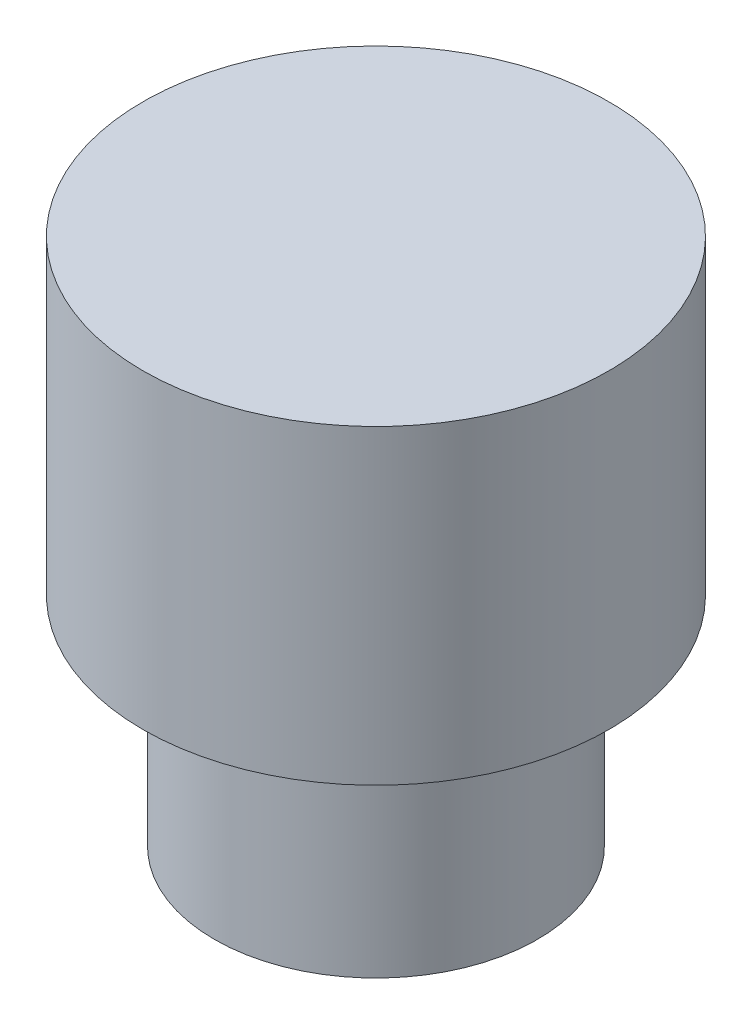
from build123d import *

# Parameters (mm, degrees)
SKETCH1_R           = 5.2
SKETCH1_R_2         = 3.2
BOSS_EXTRUDE1_DEPTH = 7
SKETCH2_R           = 7.5
BOSS_EXTRUDE2_DEPTH = 10
BOSS_EXTRUDE3_START = 0.8
BOSS_EXTRUDE3_DEPTH = 0.8


with BuildPart() as part:
    # Sketch1 → Boss-Extrude1 (new body)
    with BuildSketch(Plane(origin=(0, 0, 0), x_dir=(1, 0, 0), z_dir=(0, 1, 0))):
        Circle(SKETCH1_R)
        Circle(SKETCH1_R_2, mode=Mode.SUBTRACT)
    extrude(amount=BOSS_EXTRUDE1_DEPTH)

    # Sketch2 → Boss-Extrude2 (add)
    with BuildSketch(Plane(origin=(0, 7, 0), x_dir=(1, 0, 0), z_dir=(0, 1, 0))):
        Circle(SKETCH2_R)
    extrude(amount=BOSS_EXTRUDE2_DEPTH)

    # Sketch3 → Boss-Extrude3 (add)
    with BuildSketch(Plane.XZ.offset(-7).offset(BOSS_EXTRUDE3_START)):
        with BuildLine():
            Line((3.122498999, 0.7), (-3.122498999, 0.7))
            ThreePointArc((-3.122498999, 0.7), (-3.180565736, 0.352138611), (-3.2, 0))
            ThreePointArc((-3.2, 0), (-3.180565736, -0.352138611), (-3.122498999, -0.7))
            Line((-3.122498999, -0.7), (3.122498999, -0.7))
            ThreePointArc((3.122498999, -0.7), (3.180565736, -0.352138611), (3.2, 0))
            ThreePointArc((3.2, 0), (3.180565736, 0.352138611), (3.122498999, 0.7))
        make_face()
    extrude(amount=-BOSS_EXTRUDE3_DEPTH)


solid = part.part
